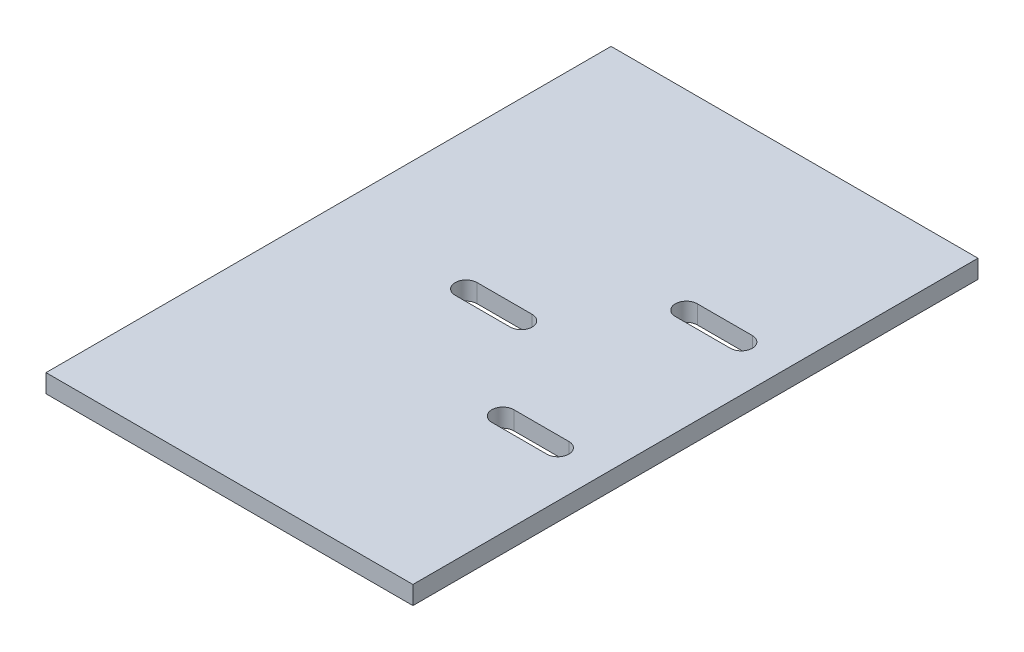
from build123d import *

# Parameters (mm, degrees)
SKETCH1_W           = 100
SKETCH1_H           = 154
BOSS_EXTRUDE1_DEPTH = 5


with BuildPart() as part:
    # Sketch1 → Boss-Extrude1 (new body)
    with BuildSketch(Plane(origin=(0, 0, 0), x_dir=(1, 0, 0), z_dir=(0, 1, 0))):
        with Locations((23.349056604, 51.646226415)):
            Rectangle(SKETCH1_W, SKETCH1_H)
        with BuildLine():
            Line((45.849056604, 79.646226415), (60.849056604, 79.646226415))
            ThreePointArc((60.849056604, 79.646226415), (63.849056604, 76.646226415), (60.849056604, 73.646226415))
            Line((60.849056604, 73.646226415), (45.849056604, 73.646226415))
            ThreePointArc((45.849056604, 73.646226415), (42.849056604, 76.646226415), (45.849056604, 79.646226415))
        make_face(mode=Mode.SUBTRACT)
        with BuildLine():
            Line((10.849056604, 54.646226415), (25.849056604, 54.646226415))
            ThreePointArc((25.849056604, 54.646226415), (28.849056604, 51.646226415), (25.849056604, 48.646226415))
            Line((25.849056604, 48.646226415), (10.849056604, 48.646226415))
            ThreePointArc((10.849056604, 48.646226415), (7.849056604, 51.646226415), (10.849056604, 54.646226415))
        make_face(mode=Mode.SUBTRACT)
        with BuildLine():
            Line((45.849056604, 29.646226415), (60.849056604, 29.646226415))
            ThreePointArc((60.849056604, 29.646226415), (63.849056604, 26.646226415), (60.849056604, 23.646226415))
            Line((60.849056604, 23.646226415), (45.849056604, 23.646226415))
            ThreePointArc((45.849056604, 23.646226415), (42.849056604, 26.646226415), (45.849056604, 29.646226415))
        make_face(mode=Mode.SUBTRACT)
    extrude(amount=BOSS_EXTRUDE1_DEPTH)


solid = part.part
